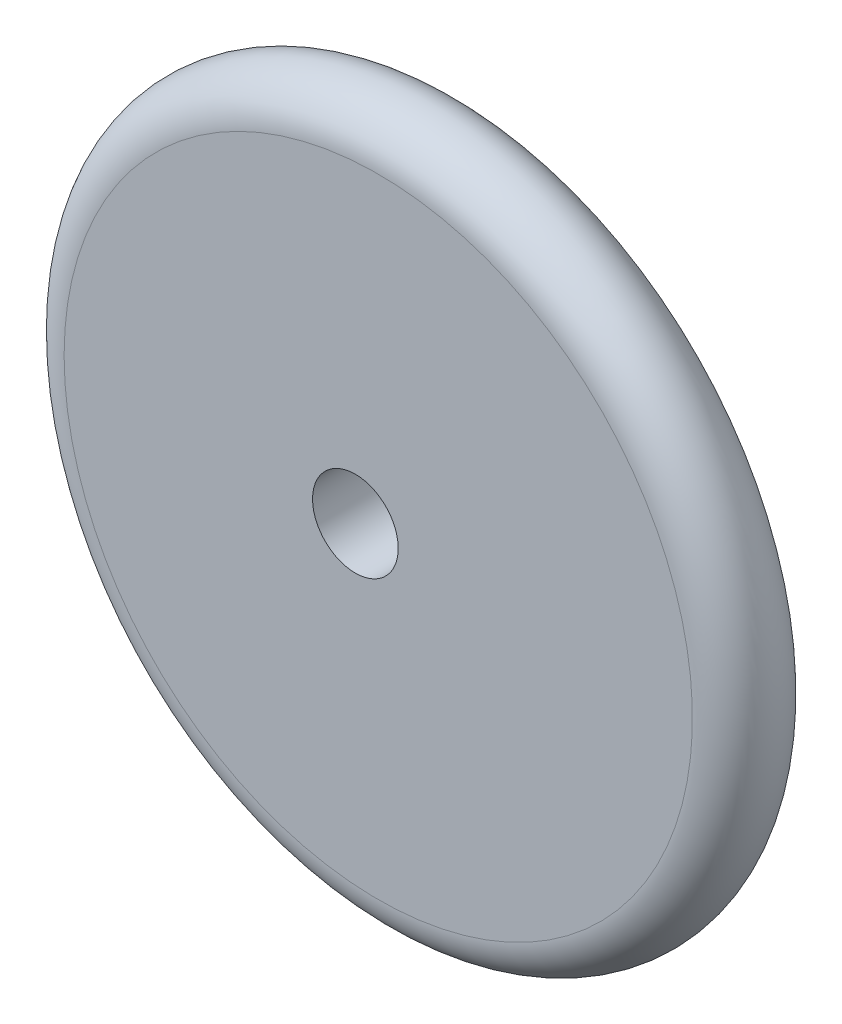
from build123d import *

# Parameters (mm, degrees)
SKETCH7_R          = 15
CUT_EXTRUDE1_DEPTH = 198.192435121


with BuildPart() as part:
    # Sketch6 → Revolve3 (revolve)
    with BuildSketch(Plane(origin=(0, 0, 0), x_dir=(1, 0, 0), z_dir=(0, 1, 0))):
        with BuildLine():
            Line((8.020431834, 74.601750373), (118.020431834, 74.601750373))
            ThreePointArc((118.020431834, 74.601750373), (133.020431834, 59.601750373), (118.020431834, 44.601750373))
            Line((118.020431834, 44.601750373), (8.020431834, 44.601750373))
            Line((8.020431834, 44.601750373), (8.020431834, 74.601750373))
        make_face()
    revolve(axis=Axis((8.020431834, 0, -74.601750373), (0, 0, 1)))

    # Sketch7 → Cut-Extrude1 (cut, through all)
    with BuildSketch(Plane.XY):
        Circle(SKETCH7_R)
    extrude(amount=-CUT_EXTRUDE1_DEPTH, mode=Mode.SUBTRACT)


solid = part.part
